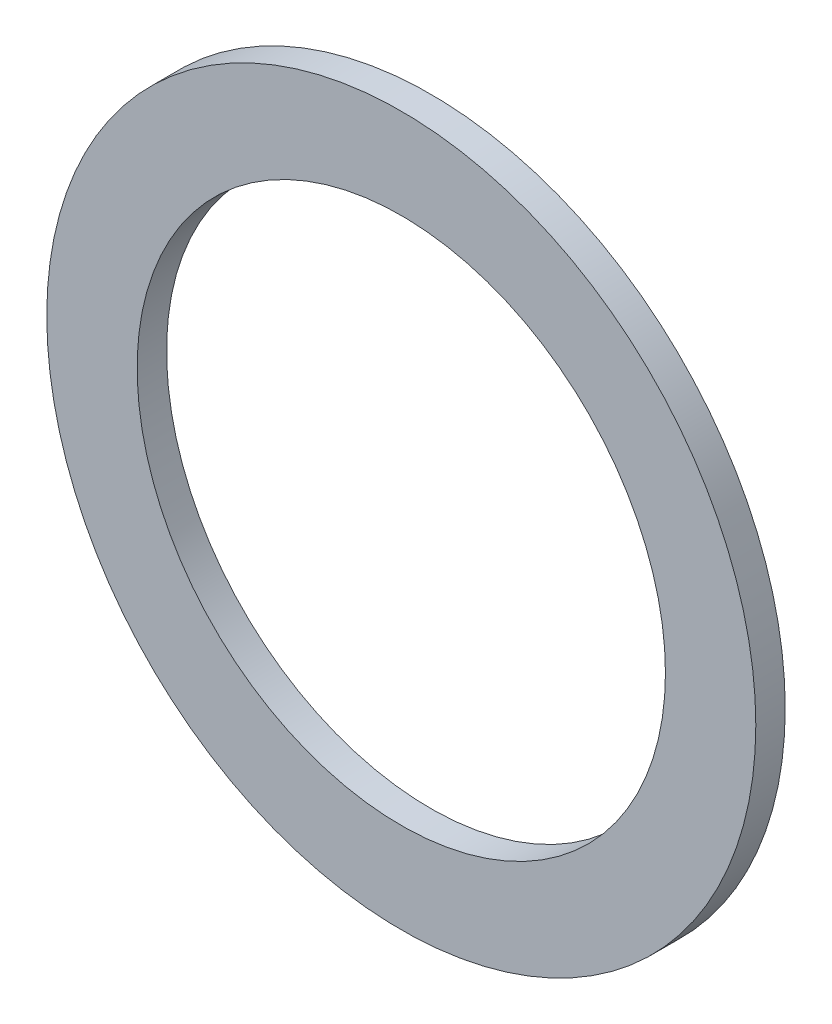
from build123d import *

# Parameters (mm, degrees)
SKETCH1_R           = 38.25
SKETCH1_R_2         = 28.5
BOSS_EXTRUDE1_DEPTH = 3.175


with BuildPart() as part:
    # Sketch1 → Boss-Extrude1 (new body)
    with BuildSketch(Plane.XY):
        Circle(SKETCH1_R)
        Circle(SKETCH1_R_2, mode=Mode.SUBTRACT)
    extrude(amount=BOSS_EXTRUDE1_DEPTH)


solid = part.part
